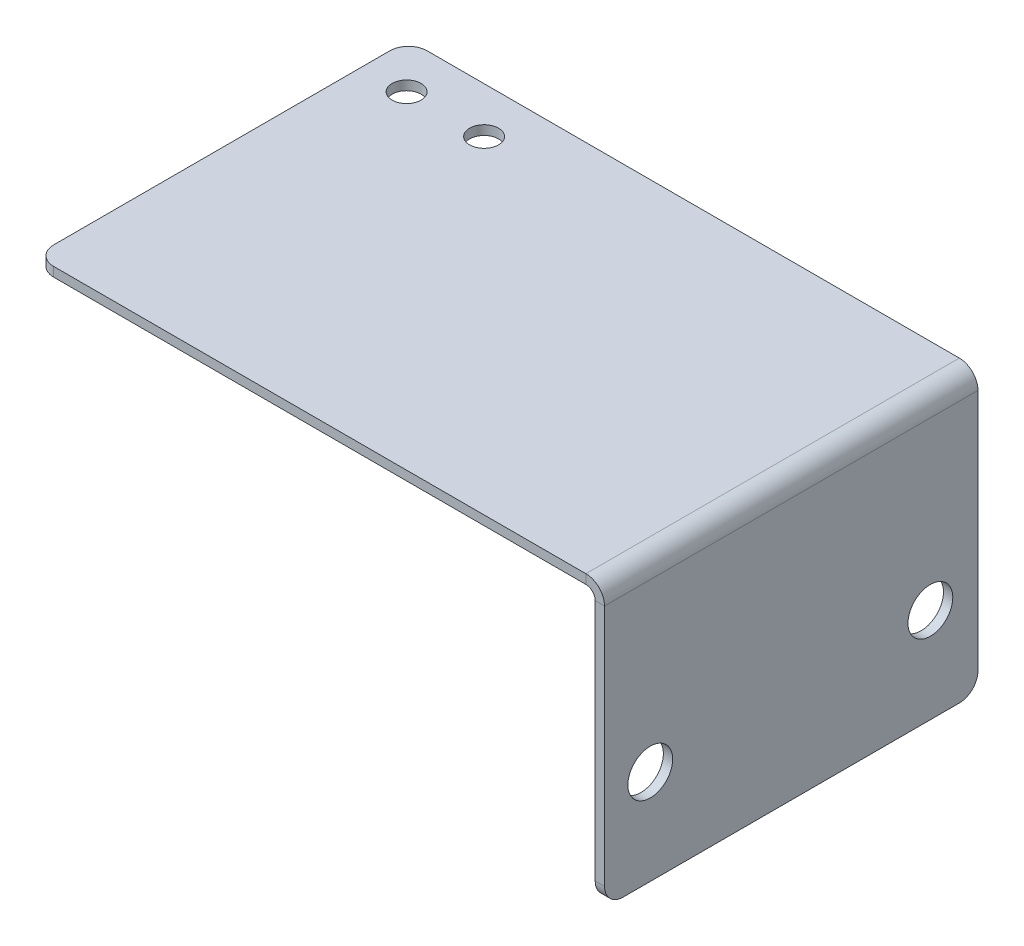
from build123d import *

# Parameters (mm, degrees)
BASE_FLANGE1_DEPTH   = 40
FILLET1_R            = 2
SKETCH6_R            = 1.55
CUT_EXTRUDE1_DEPTH   = 10
M4_CLEARANCE_HOLE1_D = 4.8


# Sheet-metal steps are written as plain solids
with BuildPart() as part:
    # Sketch1 → Base-Flange1 (new body)
    with BuildSketch(Plane.XY):
        with BuildLine():
            Line((-61, 0), (-2, 0))
            ThreePointArc((-2, 0), (-0.585786438, -0.585786438), (0, -2))
            Line((0, -2), (0, -30))
            Line((0, -30), (-1, -30))
            Line((-1, -30), (-1, -2))
            ThreePointArc((-1, -2), (-1.292893219, -1.292893219), (-2, -1))
            Line((-2, -1), (-61, -1))
            Line((-61, -1), (-61, 0))
        make_face()
    extrude(amount=BASE_FLANGE1_DEPTH)

    # Fillet1
    fillet1_edges = [part.edges().sort_by_distance(p)[0] for p in [
        (-61, -0.5, 40),
        (-61, -0.5, 0),
        (-0.5, -30, 40),
        (-0.5, -30, 0),
    ]]
    fillet(fillet1_edges, radius=FILLET1_R)

    # Sketch6 → Cut-Extrude1 (cut)
    with BuildSketch(Plane(origin=(0, 0, 0), x_dir=(1, 0, 0), z_dir=(0, 1, 0))):
        with Locations(Location((-56.3, -4.9, 0), (0, 0, 270))):
            Circle(SKETCH6_R)
        with Locations(Location((-48, -4.9, 0), (0, 0, 270))):
            Circle(SKETCH6_R)
    extrude(amount=-CUT_EXTRUDE1_DEPTH, mode=Mode.SUBTRACT)

    # M4 Clearance Hole1 (through all)
    with Locations(Plane(origin=(0, 0, 0), x_dir=(0, 0, -1), z_dir=(1, 0, 0))):
        with Locations((-35.1, -19.849994255), (-5.1, -19.849994255)):
            Hole(M4_CLEARANCE_HOLE1_D / 2)


solid = part.part
